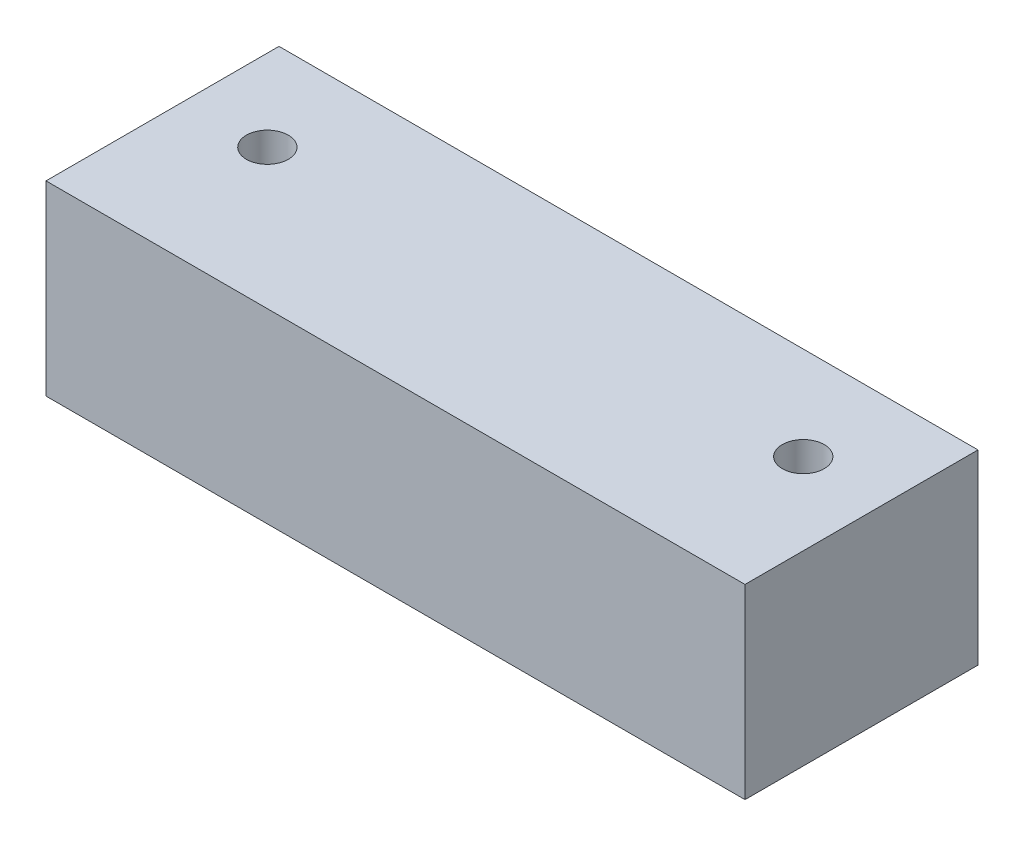
from build123d import *

# Parameters (mm, degrees)
SKETCH1_W               = 300
SKETCH1_H               = 80
BOSS_EXTRUDE1_DEPTH     = 50
CUT_EXTRUDE1_DEPTH      = 164.095064303
CUT_EXTRUDE1_DEPTH_BACK = 164.095064303
SKETCH2_R               = 9


with BuildPart() as part:
    # Sketch1 → Boss-Extrude1 (new, symmetric)
    with BuildSketch(Plane.XY):
        Rectangle(SKETCH1_W, SKETCH1_H)
    extrude(amount=BOSS_EXTRUDE1_DEPTH, both=True)

    # Sketch2 → Cut-Extrude1 (cut, two sides: drawn at the far end of the back side and taken through both)
    with BuildSketch(Plane(origin=(0, 0, 0), x_dir=(1, 0, 0), z_dir=(0, 1, 0)).offset(-CUT_EXTRUDE1_DEPTH_BACK)):
        with Locations((-115, 10)):
            Circle(SKETCH2_R)
        with Locations((115, 10)):
            Circle(SKETCH2_R)
    extrude(amount=CUT_EXTRUDE1_DEPTH + CUT_EXTRUDE1_DEPTH_BACK, mode=Mode.SUBTRACT)


solid = part.part
